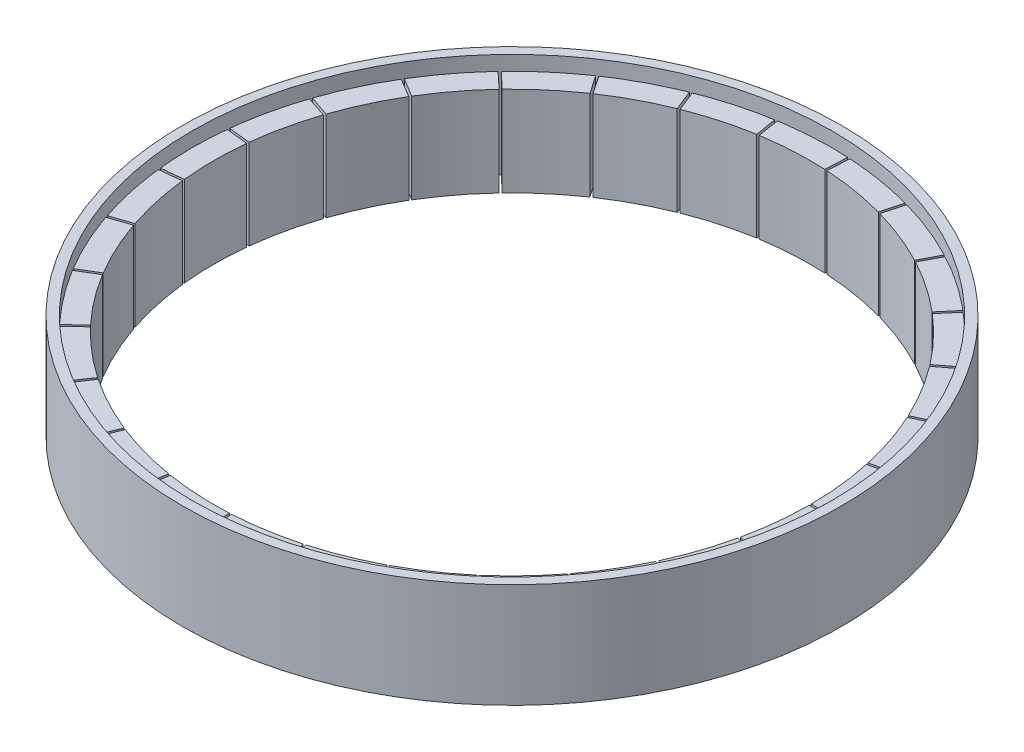
from build123d import *

# Parameters (mm, degrees)
SKETCH1_W         = 1.3
SKETCH1_H         = 14.3
SKETCH2_W         = 3
SKETCH2_H         = 12.3
REVOLVE2_ANGLE    = 12
CIRPATTERN2_COUNT = 29


with BuildPart() as part:
    # Sketch1 → Revolve1 (revolve)
    with BuildSketch(Plane.XY):
        with Locations((-44.45, 7.15)):
            Rectangle(SKETCH1_W, SKETCH1_H)
    revolve(axis=Axis((0, 0, 0), (0, -1, 0)))


with BuildPart() as body_2:
    # Sketch2 → Revolve2 (revolve, symmetric)
    with BuildSketch(Plane.XY) as revolve2_sk:
        with Locations((-42.3, 6.15)):
            Rectangle(SKETCH2_W, SKETCH2_H)
    revolve(axis=Axis((0, 0, 0), (0, 1, 0)), revolution_arc=REVOLVE2_ANGLE / 2)
    revolve(revolve2_sk.sketch, axis=Axis((0, 0, 0), (0, -1, 0)), revolution_arc=REVOLVE2_ANGLE / 2)


with BuildPart() as cirpattern2_1:
    # CirPattern2: pattern copy
    add(body_2.part.rotate(Axis((0, 0, 0), (0, 1, 0)), 1 * 360 / CIRPATTERN2_COUNT))


with BuildPart() as cirpattern2_2:
    # CirPattern2: pattern copy
    add(body_2.part.rotate(Axis((0, 0, 0), (0, 1, 0)), 2 * 360 / CIRPATTERN2_COUNT))


with BuildPart() as cirpattern2_3:
    # CirPattern2: pattern copy
    add(body_2.part.rotate(Axis((0, 0, 0), (0, 1, 0)), 3 * 360 / CIRPATTERN2_COUNT))


with BuildPart() as cirpattern2_4:
    # CirPattern2: pattern copy
    add(body_2.part.rotate(Axis((0, 0, 0), (0, 1, 0)), 4 * 360 / CIRPATTERN2_COUNT))


with BuildPart() as cirpattern2_5:
    # CirPattern2: pattern copy
    add(body_2.part.rotate(Axis((0, 0, 0), (0, 1, 0)), 5 * 360 / CIRPATTERN2_COUNT))


with BuildPart() as cirpattern2_6:
    # CirPattern2: pattern copy
    add(body_2.part.rotate(Axis((0, 0, 0), (0, 1, 0)), 6 * 360 / CIRPATTERN2_COUNT))


with BuildPart() as cirpattern2_7:
    # CirPattern2: pattern copy
    add(body_2.part.rotate(Axis((0, 0, 0), (0, 1, 0)), 7 * 360 / CIRPATTERN2_COUNT))


with BuildPart() as cirpattern2_8:
    # CirPattern2: pattern copy
    add(body_2.part.rotate(Axis((0, 0, 0), (0, 1, 0)), 8 * 360 / CIRPATTERN2_COUNT))


with BuildPart() as cirpattern2_9:
    # CirPattern2: pattern copy
    add(body_2.part.rotate(Axis((0, 0, 0), (0, 1, 0)), 9 * 360 / CIRPATTERN2_COUNT))


with BuildPart() as cirpattern2_10:
    # CirPattern2: pattern copy
    add(body_2.part.rotate(Axis((0, 0, 0), (0, 1, 0)), 10 * 360 / CIRPATTERN2_COUNT))


with BuildPart() as cirpattern2_11:
    # CirPattern2: pattern copy
    add(body_2.part.rotate(Axis((0, 0, 0), (0, 1, 0)), 11 * 360 / CIRPATTERN2_COUNT))


with BuildPart() as cirpattern2_12:
    # CirPattern2: pattern copy
    add(body_2.part.rotate(Axis((0, 0, 0), (0, 1, 0)), 12 * 360 / CIRPATTERN2_COUNT))


with BuildPart() as cirpattern2_13:
    # CirPattern2: pattern copy
    add(body_2.part.rotate(Axis((0, 0, 0), (0, 1, 0)), 13 * 360 / CIRPATTERN2_COUNT))


with BuildPart() as cirpattern2_14:
    # CirPattern2: pattern copy
    add(body_2.part.rotate(Axis((0, 0, 0), (0, 1, 0)), 14 * 360 / CIRPATTERN2_COUNT))


with BuildPart() as cirpattern2_15:
    # CirPattern2: pattern copy
    add(body_2.part.rotate(Axis((0, 0, 0), (0, 1, 0)), 15 * 360 / CIRPATTERN2_COUNT))


with BuildPart() as cirpattern2_16:
    # CirPattern2: pattern copy
    add(body_2.part.rotate(Axis((0, 0, 0), (0, 1, 0)), 16 * 360 / CIRPATTERN2_COUNT))


with BuildPart() as cirpattern2_17:
    # CirPattern2: pattern copy
    add(body_2.part.rotate(Axis((0, 0, 0), (0, 1, 0)), 17 * 360 / CIRPATTERN2_COUNT))


with BuildPart() as cirpattern2_18:
    # CirPattern2: pattern copy
    add(body_2.part.rotate(Axis((0, 0, 0), (0, 1, 0)), 18 * 360 / CIRPATTERN2_COUNT))


with BuildPart() as cirpattern2_19:
    # CirPattern2: pattern copy
    add(body_2.part.rotate(Axis((0, 0, 0), (0, 1, 0)), 19 * 360 / CIRPATTERN2_COUNT))


with BuildPart() as cirpattern2_20:
    # CirPattern2: pattern copy
    add(body_2.part.rotate(Axis((0, 0, 0), (0, 1, 0)), 20 * 360 / CIRPATTERN2_COUNT))


with BuildPart() as cirpattern2_21:
    # CirPattern2: pattern copy
    add(body_2.part.rotate(Axis((0, 0, 0), (0, 1, 0)), 21 * 360 / CIRPATTERN2_COUNT))


with BuildPart() as cirpattern2_22:
    # CirPattern2: pattern copy
    add(body_2.part.rotate(Axis((0, 0, 0), (0, 1, 0)), 22 * 360 / CIRPATTERN2_COUNT))


with BuildPart() as cirpattern2_23:
    # CirPattern2: pattern copy
    add(body_2.part.rotate(Axis((0, 0, 0), (0, 1, 0)), 23 * 360 / CIRPATTERN2_COUNT))


with BuildPart() as cirpattern2_24:
    # CirPattern2: pattern copy
    add(body_2.part.rotate(Axis((0, 0, 0), (0, 1, 0)), 24 * 360 / CIRPATTERN2_COUNT))


with BuildPart() as cirpattern2_25:
    # CirPattern2: pattern copy
    add(body_2.part.rotate(Axis((0, 0, 0), (0, 1, 0)), 25 * 360 / CIRPATTERN2_COUNT))


with BuildPart() as cirpattern2_26:
    # CirPattern2: pattern copy
    add(body_2.part.rotate(Axis((0, 0, 0), (0, 1, 0)), 26 * 360 / CIRPATTERN2_COUNT))


with BuildPart() as cirpattern2_27:
    # CirPattern2: pattern copy
    add(body_2.part.rotate(Axis((0, 0, 0), (0, 1, 0)), 27 * 360 / CIRPATTERN2_COUNT))


with BuildPart() as cirpattern2_28:
    # CirPattern2: pattern copy
    add(body_2.part.rotate(Axis((0, 0, 0), (0, 1, 0)), 28 * 360 / CIRPATTERN2_COUNT))


solid = Compound([part.part, body_2.part, cirpattern2_1.part, cirpattern2_2.part, cirpattern2_3.part, cirpattern2_4.part, cirpattern2_5.part, cirpattern2_6.part, cirpattern2_7.part, cirpattern2_8.part, cirpattern2_9.part, cirpattern2_10.part, cirpattern2_11.part, cirpattern2_12.part, cirpattern2_13.part, cirpattern2_14.part, cirpattern2_15.part, cirpattern2_16.part, cirpattern2_17.part, cirpattern2_18.part, cirpattern2_19.part, cirpattern2_20.part, cirpattern2_21.part, cirpattern2_22.part, cirpattern2_23.part, cirpattern2_24.part, cirpattern2_25.part, cirpattern2_26.part, cirpattern2_27.part, cirpattern2_28.part])
